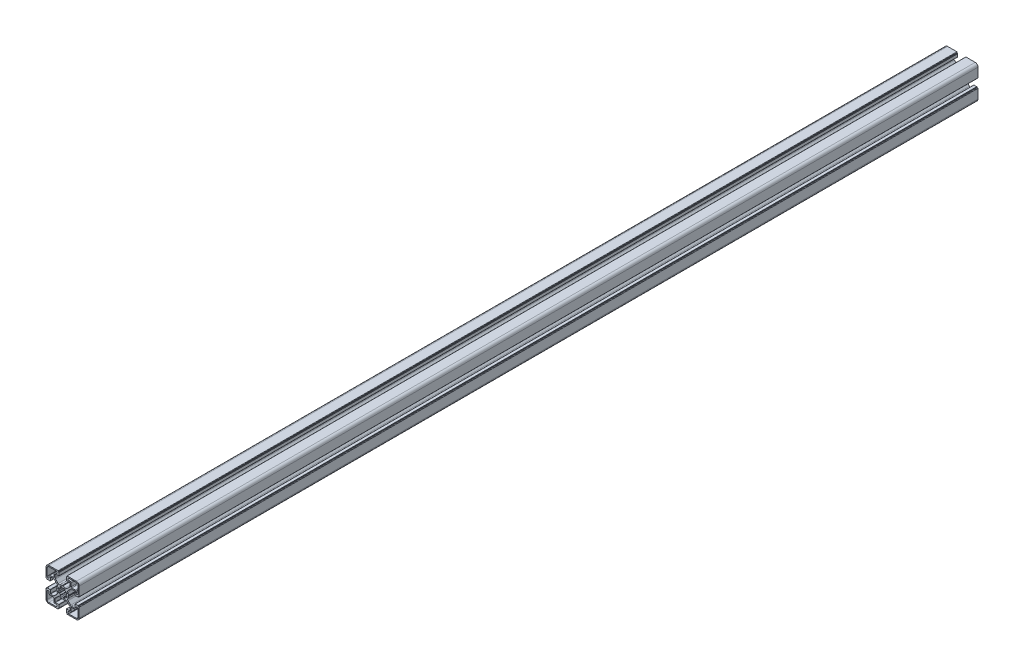
from build123d import *

# Parameters (mm, degrees)
BOSS_EXTRUDE1_DEPTH      = 609.6
FILLET4_R                = 1.95
FILLET5_R                = 0.39
DELETEFACE1_START        = -609.6
DELETEFACE1_DEPTH        = 1219.2
CUT_EXTRUDE1_DEPTH       = 611.429897695
CIRPATTERN2_COUNT        = 3
CIRPATTERN2_ANGLE        = 180
FILLET2_R                = 0.39
FILLET3_R                = 0.195
CUT_EXTRUDE2_DEPTH       = 1220.615160614
CUT_EXTRUDE2_DEPTH_BACK  = 1220.615160614
SKETCH5_R                = 6.375
BOSS_EXTRUDE2_DEPTH      = 609.6
FILLET6_R                = 0.39
CIRPATTERN1_COUNT        = 8
FILLET6_OF_CIRPATTERN1_R = 0.39
CUT_EXTRUDE3_DEPTH       = 611.429897695
CUT_EXTRUDE3_DEPTH_BACK  = 611.429897695


# Read off the part's stored shape, not the designer's step: DeleteFace1
with BuildPart() as part:
    # Sketch3 → Boss-Extrude1 (new, symmetric)
    with BuildSketch(Plane.XY):
        with BuildLine():
            Line((0, -8), (0, -5))
            ThreePointArc((0, -5), (3.535533906, -3.535533906), (5, 0))
            Line((5, 0), (8, 0))
            ThreePointArc((8, 0), (7.578104083, -2.563657252), (6.356915373, -4.856915373))
            Line((6.356915373, -4.856915373), (11.55, -10.05))
            Line((11.55, -10.05), (16.7, -10.05))
            Line((16.7, -10.05), (16.7, -5))
            Line((16.7, -5), (21, -5))
            Line((21, -5), (21, 0))
            Line((21, 0), (22.5, 0))
            Line((22.5, 0), (22.5, -18.75))
            ThreePointArc((22.5, -18.75), (21.401650429, -21.401650429), (18.75, -22.5))
            Line((18.75, -22.5), (0, -22.5))
            Line((0, -22.5), (0, -21))
            Line((0, -21), (5, -21))
            Line((5, -21), (5, -16.7))
            Line((5, -16.7), (10.05, -16.7))
            Line((10.05, -16.7), (10.05, -11.55))
            Line((10.05, -11.55), (4.856915373, -6.356915373))
            ThreePointArc((4.856915373, -6.356915373), (2.563657252, -7.578104083), (0, -8))
        make_face()
        with BuildLine():
            Line((18.2, -8.79375), (18.2, -10.575))
            ThreePointArc((18.2, -10.575), (17.914429112, -11.264429112), (17.225, -11.55))
            Line((17.225, -11.55), (12.525, -11.55))
            ThreePointArc((12.525, -11.55), (11.835570888, -11.835570888), (11.55, -12.525))
            Line((11.55, -12.525), (11.55, -17.225))
            ThreePointArc((11.55, -17.225), (11.264429112, -17.914429112), (10.575, -18.2))
            Line((10.575, -18.2), (8.79375, -18.2))
            ThreePointArc((8.79375, -18.2), (7.39375, -19.6), (8.79375, -21))
            Line((8.79375, -21), (18.75, -21))
            ThreePointArc((18.75, -21), (20.340990258, -20.340990258), (21, -18.75))
            Line((21, -18.75), (21, -8.79375))
            ThreePointArc((21, -8.79375), (19.6, -7.39375), (18.2, -8.79375))
        make_face(mode=Mode.SUBTRACT)
    extrude(amount=BOSS_EXTRUDE1_DEPTH, both=True)

    # Fillet4
    fillet4_edges = [part.edges().sort_by_distance(p)[0] for p in [
        (10.05, -11.55, 0),
        (4.856915373, -6.356915373, 0),
        (6.356915373, -4.856915373, 0),
        (11.55, -10.05, 0),
    ]]
    fillet(fillet4_edges, radius=FILLET4_R)

    # Fillet5
    fillet5_edges = [part.edges().sort_by_distance(p)[0] for p in [
        (5, -21, 0),
        (5, -16.7, 0),
        (10.05, -16.7, 0),
        (16.7, -10.05, 0),
        (16.7, -5, 0),
        (21, -5, 0),
    ]]
    fillet(fillet5_edges, radius=FILLET5_R)

    # Mirror1: part across plane


with BuildPart() as part_1:
    add(part.part)
    add(part.part.mirror(Plane.ZX))

    # DeleteFace1 outline → DeleteFace1 (cut)
    with BuildSketch(Plane.XY.offset(DELETEFACE1_START)):
        with BuildLine():
            ThreePointArc((4.61, 21), (4.885771645, 20.885771645), (5, 20.61))
            Line((5, 20.61), (5, 21))
            Line((5, 21), (4.61, 21))
        make_face()
    extrude(amount=DELETEFACE1_DEPTH, mode=Mode.SUBTRACT)

    # Sketch4 → Cut-Extrude1 (cut, symmetric)
    with BuildSketch(Plane.XY):
        Polygon((5.8, 21), (5.8, 22.5), (0, 22.5), (-5.8, 22.5), (-5.8, 21), (-5, 21), (-5, 16.7), (5, 16.7), (5, 21), align=None)
    cut_extrude1 = extrude(amount=CUT_EXTRUDE1_DEPTH, both=True, mode=Mode.SUBTRACT)

    # CirPattern2: Cut-Extrude1 ×3 about axis
    cirpattern2_axis = Axis((0, 0, 564.6), (0, 0, -1))
    for i in range(1, CIRPATTERN2_COUNT):
        add(cut_extrude1.rotate(cirpattern2_axis, i * CIRPATTERN2_ANGLE / (CIRPATTERN2_COUNT - 1)), mode=Mode.SUBTRACT)

    # Fillet2
    fillet2_edges = [part_1.edges().sort_by_distance(p)[0] for p in [
        (5.8, 22.5, 0),
        (22.5, 5.8, 0),
        (22.5, -5.8, 0),
        (5.8, -22.5, 0),
    ]]
    fillet(fillet2_edges, radius=FILLET2_R)

    # Fillet3
    fillet3_edges = [part_1.edges().sort_by_distance(p)[0] for p in [
        (5, 21, 0),
        (5.8, 21, 0),
        (21, -5, 0),
        (21, -5.8, 0),
        (21, 5, 0),
        (21, 5.8, 0),
        (5, -21, 0),
        (5.8, -21, 0),
    ]]
    fillet(fillet3_edges, radius=FILLET3_R)

    # Mirror2: part across plane


with BuildPart() as part_2:
    add(part_1.part)
    add(part_1.part.mirror(Plane(origin=(0, 0, 0), x_dir=(0, 0, 1), z_dir=(1, 0, 0))))

    # Sketch5 → Cut-Extrude2 (cut, two sides: drawn at the far end of the back side and taken through both)
    with BuildSketch(Plane.XY.offset(609.6).offset(-CUT_EXTRUDE2_DEPTH_BACK)):
        Circle(SKETCH5_R)
        Polygon((-0.580185128, 8), (0.580185128, 8), (0, 7.59375), align=None)
        Polygon((-8, 0.580185128), (-8, -0.580185128), (-7.59375, 0), align=None)
        Polygon((8, 0.580185128), (8, -0.580185128), (7.59375, 0), align=None)
        Polygon((-0.580185128, -8), (0.580185128, -8), (0, -7.59375), align=None)
    extrude(amount=CUT_EXTRUDE2_DEPTH + CUT_EXTRUDE2_DEPTH_BACK, mode=Mode.SUBTRACT)

    # Sketch6 → Boss-Extrude2 (add, symmetric)
    with BuildSketch(Plane.XY):
        with BuildLine():
            Line((-0.97545161, -4.903926402), (-1.243700803, -6.252506163))
            ThreePointArc((-1.243700803, -6.252506163), (0, -6.375), (1.243700803, -6.252506163))
            Line((1.243700803, -6.252506163), (0.97545161, -4.903926402))
            ThreePointArc((0.97545161, -4.903926402), (0, -5), (-0.97545161, -4.903926402))
        make_face()
    boss_extrude2 = extrude(amount=BOSS_EXTRUDE2_DEPTH, both=True)

    # Fillet6
    fillet6_edges = [part_2.edges().sort_by_distance(p)[0] for p in [
        (-1.243700803, -6.252506163, 0),
        (1.243700803, -6.252506163, 0),
    ]]
    fillet(fillet6_edges, radius=FILLET6_R)

    # CirPattern1: Boss-Extrude2 ×8 about axis
    cirpattern1_axis = Axis((0, 0, 0), (0, 0, 1))
    for i in range(1, CIRPATTERN1_COUNT):
        add(boss_extrude2.rotate(cirpattern1_axis, i * 360 / CIRPATTERN1_COUNT))

    # Fillet6 of CirPattern1
    fillet6_of_cirpattern1_edges = [part_2.edges().sort_by_distance(p)[0] for p in [
        (3.541760235, -5.300618778, 0),
        (5.300618778, -3.541760235, 0),
        (6.252506163, -1.243700803, 0),
        (6.252506163, 1.243700803, 0),
        (5.300618778, 3.541760235, 0),
        (3.541760235, 5.300618778, 0),
        (1.243700803, 6.252506163, 0),
        (-1.243700803, 6.252506163, 0),
        (-3.541760235, 5.300618778, 0),
        (-5.300618778, 3.541760235, 0),
        (-6.252506163, 1.243700803, 0),
        (-6.252506163, -1.243700803, 0),
        (-5.300618778, -3.541760235, 0),
        (-3.541760235, -5.300618778, 0),
    ]]
    fillet(fillet6_of_cirpattern1_edges, radius=FILLET6_OF_CIRPATTERN1_R)

    # Sketch7 → Cut-Extrude3 (cut, two sides: drawn at the far end of the back side and taken through both)
    with BuildSketch(Plane.XY.offset(-CUT_EXTRUDE3_DEPTH_BACK)):
        Polygon((-7.046875, 16.7), (-6.596875, 17.15), (-6.146875, 16.7), align=None)
    extrude(amount=CUT_EXTRUDE3_DEPTH + CUT_EXTRUDE3_DEPTH_BACK, mode=Mode.SUBTRACT)


solid = part_2.part
